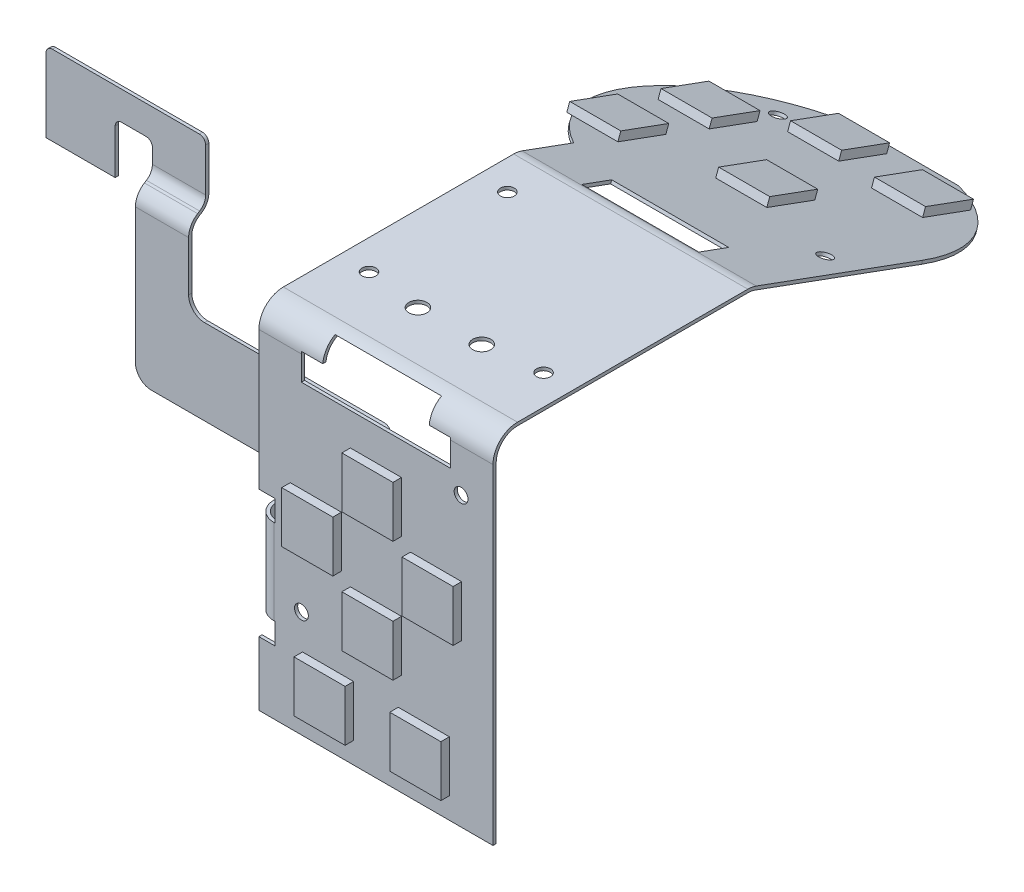
from build123d import *

# Parameters (mm, degrees)
EXTRUDE_1_DEPTH     = 22
CUT_EXTRUDE_1_DEPTH = 4
CUT_EXTRUDE_2_DEPTH = 64.319089808
SKETCH_3_3_R        = 14
EXTRUDE_2_DEPTH     = 0.3
SKETCH_4_W          = 4.8
SKETCH_4_H          = 4.8
EXTRUDE_3_DEPTH     = 0.8
SKETCH_5_R          = 0.85
CUT_EXTRUDE_3_DEPTH = 63.897702188
SKETCH_6_W          = 11
SKETCH_6_H          = 3
CUT_EXTRUDE_4_DEPTH = 1
SKETCH_7_W          = 4.8
SKETCH_7_H          = 4.8
EXTRUDE_4_DEPTH     = 0.8
SKETCH_9_W          = 1.5
SKETCH_9_H          = 0.3
CUT_EXTRUDE_5_DEPTH = 10
EXTRUDE_5_DEPTH     = 8
EXTRUDE_6_DEPTH     = 0.3
EXTRUDE_7_DEPTH     = 5
EXTRUDE_8_DEPTH     = 0.3
SKETCH_14_R         = 0.65
SKETCH_14_W         = 12
SKETCH_14_H         = 2
CUT_EXTRUDE_6_DEPTH = 4
SKETCH_15_R         = 0.65
CUT_EXTRUDE_7_DEPTH = 4
SKETCH_16_R         = 0.65
CUT_EXTRUDE_8_DEPTH = 4
EXTRUDE_9_DEPTH     = 0.3
SKETCH_18_W         = 4.8
SKETCH_18_H         = 4.8
EXTRUDE_10_DEPTH    = 0.8


with BuildPart() as part:
    # 草图1 → 凸台-拉伸1 (new body)
    with BuildSketch(Plane(origin=(0, 0, 0), x_dir=(0, 0, -1), z_dir=(1, 0, 0))):
        with BuildLine():
            Line((0, -25), (0, -2))
            ThreePointArc((0, -2), (0.585786438, -0.585786438), (2, 0))
            Line((2, 0), (23.64572618, 0))
            ThreePointArc((23.64572618, 0), (23.99456936, -0.030657867), (24.332717753, -0.121691565))
            Line((24.332717753, -0.121691565), (52.174626532, -10.304873595))
            Line((52.174626532, -10.304873595), (52.277675268, -10.023127329))
            Line((52.277675268, -10.023127329), (24.435766489, 0.160054701))
            ThreePointArc((24.435766489, 0.160054701), (24.046895837, 0.264743453), (23.64572618, 0.3))
            Line((23.64572618, 0.3), (2, 0.3))
            ThreePointArc((2, 0.3), (0.373654403, -0.373654403), (-0.3, -2))
            Line((-0.3, -2), (-0.3, -25))
            Line((-0.3, -25), (0, -25))
        make_face()
    extrude(amount=EXTRUDE_1_DEPTH)

    # 草图2 → 切除-拉伸1 (cut)
    with BuildSketch(Plane.XY.offset(0.3)):
        Polygon((4, -4.3), (18, -4.3), (18, -1.8), (16, -1.8), (16, 0), (6, 0), (6, -1.8), (4, -1.8), align=None)
    extrude(amount=-CUT_EXTRUDE_1_DEPTH, mode=Mode.SUBTRACT)

    # 草图3 → 切除-拉伸2 (cut, through all)
    with BuildSketch(Plane(origin=(0, 8.024038665, -2.934793264), x_dir=(1, 0, 0), z_dir=(0, 0.9391542177229502, -0.3434957864853564))):
        with BuildLine():
            ThreePointArc((13.196152423, 52.539701225), (19.591939741, 47.38998358), (22, 39.539701225))
            Line((22, 39.539701225), (22, 52.539701225))
            Line((22, 52.539701225), (13.196152423, 52.539701225))
        make_face()
        with BuildLine():
            ThreePointArc((0, 51.028826518), (1.358818231, 51.864258204), (2.803847577, 52.539701225))
            Line((2.803847577, 52.539701225), (0, 52.539701225))
            Line((0, 52.539701225), (0, 51.028826518))
        make_face()
    extrude(amount=-CUT_EXTRUDE_2_DEPTH, mode=Mode.SUBTRACT)

    # 草图3<3> → 凸台-拉伸2 (add)
    with BuildSketch(Plane(origin=(0, 8.024038665, -2.934793264), x_dir=(1, 0, 0), z_dir=(0, 0.9391542177229502, -0.3434957864853564))):
        with Locations((8, 39.539701225)):
            Circle(SKETCH_3_3_R)
    extrude(amount=-EXTRUDE_2_DEPTH)

    # 草图4 → 凸台-拉伸3 (add)
    with BuildSketch(Plane.XY.offset(0.3)):
        with Locations((11, -9.75)):
            Rectangle(SKETCH_4_W, SKETCH_4_H)
        with Locations((11, -21.05)):
            Rectangle(SKETCH_4_W, SKETCH_4_H)
        with Locations((5.35, -15.4)):
            Rectangle(SKETCH_4_W, SKETCH_4_H)
        with Locations((16.65, -15.4)):
            Rectangle(SKETCH_4_W, SKETCH_4_H)
    extrude(amount=EXTRUDE_3_DEPTH)

    # 草图5 → 切除-拉伸3 (cut, through all)
    with BuildSketch(Plane(origin=(0, 0.3, 0), x_dir=(1, 0, 0), z_dir=(0, 1, 0))):
        with Locations((8, 6.64572618)):
            Circle(SKETCH_5_R)
        with Locations((14, 6.64572618)):
            Circle(SKETCH_5_R)
    extrude(amount=-CUT_EXTRUDE_3_DEPTH, mode=Mode.SUBTRACT)

    # 草图6 → 切除-拉伸4 (cut)
    with BuildSketch(Plane(origin=(0, 8.024038665, -2.934793264), x_dir=(1, 0, 0), z_dir=(0, 0.9391542177229502, -0.3434957864853564))):
        with Locations((11, 24.5)):
            Rectangle(SKETCH_6_W, SKETCH_6_H)
    extrude(amount=-CUT_EXTRUDE_4_DEPTH, mode=Mode.SUBTRACT)

    # 草图7 → 凸台-拉伸4 (add)
    with BuildSketch(Plane(origin=(0, 8.024038665, -2.934793264), x_dir=(1, 0, 0), z_dir=(0, 0.9391542177229502, -0.3434957864853564))):
        with Locations((9.738477049, 36.851443585)):
            Rectangle(SKETCH_7_W, SKETCH_7_H)
        with Locations((14.118767038, 47.774445204)):
            Rectangle(SKETCH_7_W, SKETCH_7_H)
        with Locations((5.219570287, 48.855656024)):
            Rectangle(SKETCH_7_W, SKETCH_7_H)
        with Locations((-1.489481468, 43.037611303)):
            Rectangle(SKETCH_7_W, SKETCH_7_H)
        with Locations((-1.651961899, 34.079108149)):
            Rectangle(SKETCH_7_W, SKETCH_7_H)
    extrude(amount=EXTRUDE_4_DEPTH)

    # 草图9 → 切除-拉伸5 (cut)
    with BuildSketch(Plane.XZ.offset(25)):
        with Locations((0.75, 0.15)):
            Rectangle(SKETCH_9_W, SKETCH_9_H)
    extrude(amount=-CUT_EXTRUDE_5_DEPTH, mode=Mode.SUBTRACT)

    # 草图10 → 凸台-拉伸5 (add)
    with BuildSketch(Plane.XZ.offset(25)):
        with BuildLine():
            Line((1.5, 0), (1.4, 0))
            ThreePointArc((1.4, 0), (0.339339828, -0.439339828), (-0.1, -1.5))
            Line((-0.1, -1.5), (-0.1, -11.5))
            ThreePointArc((-0.1, -11.5), (-0.539339828, -12.560660172), (-1.6, -13))
            Line((-1.6, -13), (-17.6, -13))
            Line((-17.6, -13), (-17.6, -12.7))
            Line((-17.6, -12.7), (-1.6, -12.7))
            ThreePointArc((-1.6, -12.7), (-0.751471863, -12.348528137), (-0.4, -11.5))
            Line((-0.4, -11.5), (-0.4, -1.5))
            ThreePointArc((-0.4, -1.5), (0.127207794, -0.227207794), (1.4, 0.3))
            Line((1.4, 0.3), (1.5, 0.3))
            Line((1.5, 0.3), (1.5, 0))
        make_face()
    extrude(amount=-EXTRUDE_5_DEPTH)

    # 草图11 → 凸台-拉伸6 (add)
    with BuildSketch(Plane.XY.offset(-12.7)):
        with BuildLine():
            Line((-17.6, -17), (-17.6, -25))
            Line((-17.6, -25), (-23.1, -25))
            ThreePointArc((-23.1, -25), (-24.160660172, -24.560660172), (-24.6, -23.5))
            Line((-24.6, -23.5), (-24.6, -11))
            Line((-24.6, -11), (-19.6, -11))
            Line((-19.6, -11), (-19.6, -15.5))
            ThreePointArc((-19.6, -15.5), (-19.160660172, -16.560660172), (-18.1, -17))
            Line((-18.1, -17), (-17.6, -17))
        make_face()
    extrude(amount=-EXTRUDE_6_DEPTH)

    # 草图12 → 凸台-拉伸7 (add)
    with BuildSketch(Plane.ZY.offset(24.6)):
        with BuildLine():
            Line((-13, -11), (-13, -10.831371462))
            ThreePointArc((-13, -10.831371462), (-13.188036278, -10.104218664), (-13.70500159, -9.559374006))
            Line((-13.70500159, -9.559374006), (-13.89499841, -9.440625994))
            ThreePointArc((-13.89499841, -9.440625994), (-14.411963722, -8.895781336), (-14.6, -8.168628538))
            Line((-14.6, -8.168628538), (-14.6, -8))
            Line((-14.6, -8), (-14.3, -8))
            Line((-14.3, -8), (-14.3, -8.168628538))
            ThreePointArc((-14.3, -8.168628538), (-14.149570977, -8.750350777), (-13.735998728, -9.186226503))
            Line((-13.735998728, -9.186226503), (-13.546001908, -9.304974515))
            ThreePointArc((-13.546001908, -9.304974515), (-12.925643534, -9.958788104), (-12.7, -10.831371462))
            Line((-12.7, -10.831371462), (-12.7, -11))
            Line((-12.7, -11), (-13, -11))
        make_face()
    extrude(amount=-EXTRUDE_7_DEPTH)

    # 草图13 → 凸台-拉伸8 (add)
    with BuildSketch(Plane.XY.offset(-14.3)):
        with BuildLine():
            Line((-24.6, -8), (-19.6, -8))
            Line((-19.6, -8), (-19.6, -4.1))
            ThreePointArc((-19.6, -4.1), (-19.775735931, -3.675735931), (-20.2, -3.5))
            Line((-20.2, -3.5), (-34, -3.5))
            ThreePointArc((-34, -3.5), (-34.424264069, -3.675735931), (-34.6, -4.1))
            Line((-34.6, -4.1), (-34.6, -11))
            Line((-34.6, -11), (-28.1, -11))
            Line((-28.1, -11), (-28.1, -6.8))
            ThreePointArc((-28.1, -6.8), (-27.924264069, -6.375735931), (-27.5, -6.2))
            Line((-27.5, -6.2), (-25.2, -6.2))
            ThreePointArc((-25.2, -6.2), (-24.775735931, -6.375735931), (-24.6, -6.8))
            Line((-24.6, -6.8), (-24.6, -8))
        make_face()
    extrude(amount=-EXTRUDE_8_DEPTH)

    # 草图14 → 切除-拉伸6 (cut)
    with BuildSketch(Plane(origin=(0, 8.024038665, -2.934793264), x_dir=(1, 0, 0), z_dir=(0, 0.9391542177229502, -0.3434957864853564))):
        with Locations((0.5, 47.950575932)):
            Circle(SKETCH_14_R)
        with Locations((19.5, 32.450575932)):
            Circle(SKETCH_14_R)
        with Locations((8, 53.550575932)):
            Rectangle(SKETCH_14_W, SKETCH_14_H)
    extrude(amount=-CUT_EXTRUDE_6_DEPTH, mode=Mode.SUBTRACT)

    # 草图15 → 切除-拉伸7 (cut)
    with BuildSketch(Plane(origin=(0, 0.3, 0), x_dir=(1, 0, 0), z_dir=(0, 1, 0))):
        with Locations((2.8, 20.25)):
            Circle(SKETCH_15_R)
        with Locations((2.8, 7.25)):
            Circle(SKETCH_15_R)
        with Locations((19.2, 7.25)):
            Circle(SKETCH_15_R)
    extrude(amount=-CUT_EXTRUDE_7_DEPTH, mode=Mode.SUBTRACT)

    # 草图16 → 切除-拉伸8 (cut)
    with BuildSketch(Plane.XY.offset(0.3)):
        with Locations((19, -6)):
            Circle(SKETCH_16_R)
        with Locations((4, -23)):
            Circle(SKETCH_16_R)
    extrude(amount=-CUT_EXTRUDE_8_DEPTH, mode=Mode.SUBTRACT)

    # 草图17 → 凸台-拉伸9 (add)
    with BuildSketch(Plane.XY.offset(0.3)):
        Polygon((22, -25), (22, -33), (0, -33), (0, -27), (1.5, -27), (1.5, -25), align=None)
    extrude(amount=-EXTRUDE_9_DEPTH)

    # 草图18 → 凸台-拉伸10 (add)
    with BuildSketch(Plane.XY.offset(0.3)):
        with Locations((6.5, -28.6)):
            Rectangle(SKETCH_18_W, SKETCH_18_H)
        with Locations((15.5, -28.6)):
            Rectangle(SKETCH_18_W, SKETCH_18_H)
    extrude(amount=EXTRUDE_10_DEPTH)


solid = part.part
